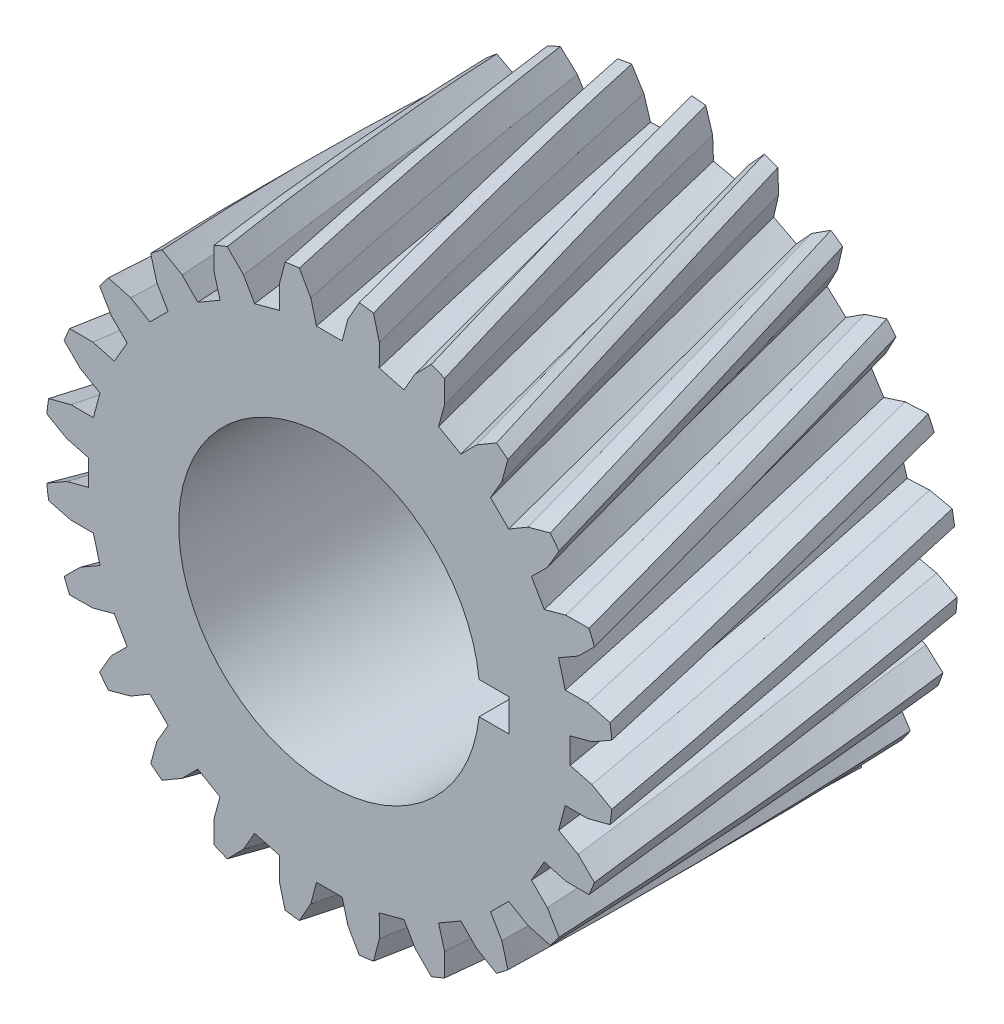
from build123d import *

# Parameters (mm, degrees)
SKETCH1_R              = 13.2
BOSS_EXTRUDE1_DEPTH    = 16
CUT_SWEEP1_PITCH       = 330
CUT_SWEEP1_HEIGHT      = 16.5
CUT_SWEEP1_RADIUS      = 13.2
CUT_SWEEP1_START_ANGLE = 90
CIRPATTERN1_COUNT      = 24
SKETCH5_R              = 8.875
BOSS_EXTRUDE2_DEPTH    = 0.2
SKETCH6_R              = 7
CUT_EXTRUDE1_DEPTH     = 39.2
CUT_EXTRUDE2_DEPTH     = 39.2


with BuildPart() as part:
    # Sketch1 → Boss-Extrude1 (new body)
    with BuildSketch(Plane.XY):
        Circle(SKETCH1_R)
    extrude(amount=BOSS_EXTRUDE1_DEPTH)

    # Cut-Sweep1: sweep along a helix
    with BuildLine() as cut_sweep1_path:
        add(Helix(CUT_SWEEP1_PITCH, CUT_SWEEP1_HEIGHT, CUT_SWEEP1_RADIUS, center=(0, 0, 16), direction=(0, 0, -1), lefthand=True, mode=Mode.PRIVATE).rotate(Axis((0, 0, 16), (0, 0, -1)), CUT_SWEEP1_START_ANGLE))
    # Sketch4 → Cut-Sweep1 (sweep, cut)
    with BuildSketch(Plane.XY.offset(16)):
        Polygon((-0.595991254, 11.188754429), (0.595991254, 11.188754429), (0.861124845, 12.194377215), (1.513768871, 13.340513865), (-1.513768871, 13.340513865), (-0.861124845, 12.194377215), align=None)
    cut_sweep1 = sweep(path=cut_sweep1_path.line, is_frenet=True, mode=Mode.SUBTRACT)

    # CirPattern1: Cut-Sweep1 ×24 about axis
    cirpattern1_axis = Axis((0, 0, 0), (0, 0, 1))
    for i in range(1, CIRPATTERN1_COUNT):
        add(cut_sweep1.rotate(cirpattern1_axis, i * 360 / CIRPATTERN1_COUNT), mode=Mode.SUBTRACT)

    # Sketch5 → Boss-Extrude2 (add)
    with BuildSketch(Plane(origin=(0, 0, 0), x_dir=(-1, 0, 0), z_dir=(0, 0, -1))):
        with Locations(Location((0, 0, 0), (0, 0, 180))):
            Circle(SKETCH5_R)
    extrude(amount=BOSS_EXTRUDE2_DEPTH)

    # Sketch6 → Cut-Extrude1 (cut)
    with BuildSketch(Plane(origin=(0, 0, -0.2), x_dir=(-1, 0, 0), z_dir=(0, 0, -1))):
        Circle(SKETCH6_R)
    extrude(amount=-CUT_EXTRUDE1_DEPTH, mode=Mode.SUBTRACT)

    # Sketch7 → Cut-Extrude2 (cut)
    with BuildSketch(Plane(origin=(0, 0, -0.2), x_dir=(-1, 0, 0), z_dir=(0, 0, -1))):
        Polygon((-6.937847543, 0.75), (-8.337847543, 0.75), (-8.337847543, -0.75), (-6.937847543, -0.75), (-7, 0), align=None)
    extrude(amount=-CUT_EXTRUDE2_DEPTH, mode=Mode.SUBTRACT)


solid = part.part
